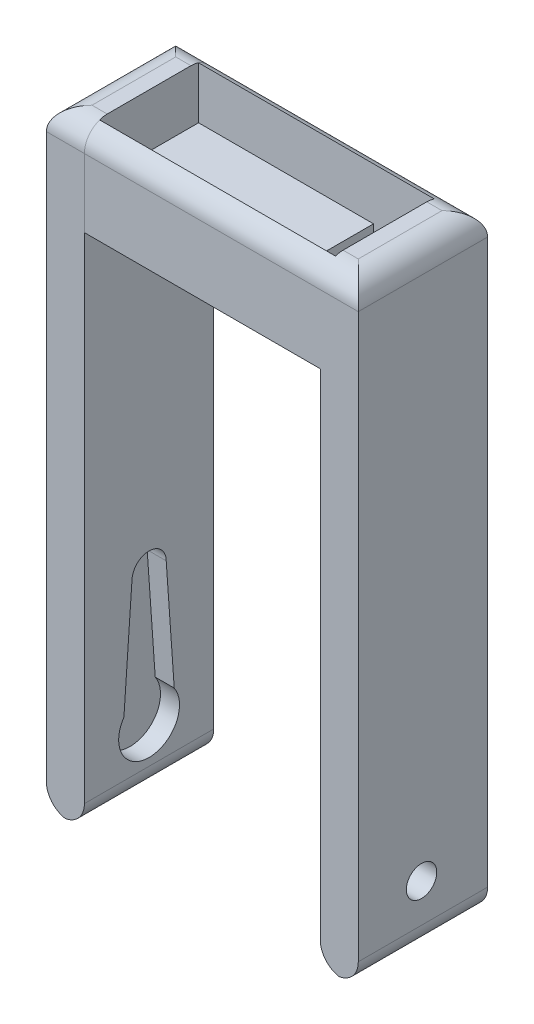
from build123d import *

# Parameters (mm, degrees)
SKETCH1_W             = 5
SKETCH1_H             = 17
BOSS_EXTRUDE1_DEPTH   = 80
BOSS_EXTRUDE1_2_DEPTH = 80
CUT_EXTRUDE1_DEPTH    = 2.5
BOSS_EXTRUDE2_REACH   = 91.359
SKETCH5_W             = 3
SKETCH5_H             = 13
CUT_EXTRUDE2_DEPTH    = 5
FILLET1_R             = 3
FILLET2_R             = 3
SKETCH6_R             = 2
CUT_EXTRUDE3_DEPTH    = 90.358827208


with BuildPart() as part:
    # Sketch1 → Boss-Extrude1 (new body)
    with BuildSketch(Plane(origin=(0, 0, 0), x_dir=(1, 0, 0), z_dir=(0, 1, 0))):
        with Locations((2.5, -8.5)):
            Rectangle(SKETCH1_W, SKETCH1_H)
    extrude(amount=BOSS_EXTRUDE1_DEPTH)

    # Sketch2 → Cut-Extrude1 (cut)
    with BuildSketch(Plane(origin=(5, 0, 0), x_dir=(0, 0, -1), z_dir=(1, 0, 0))):
        with BuildLine():
            Line((-10.75, 25.267799715), (-11.807189139, 10.25))
            ThreePointArc((-11.807189139, 10.25), (-8.5, 12), (-5.192810861, 10.25))
            Line((-5.192810861, 10.25), (-6.25, 25.267799715))
            ThreePointArc((-6.25, 25.267799715), (-8.5, 27.517799715), (-10.75, 25.267799715))
        make_face()
        with BuildLine():
            ThreePointArc((-5.192810861, 10.25), (-8.5, 12), (-11.807189139, 10.25))
            Line((-11.807189139, 10.25), (-11.807189139, 5.75))
            ThreePointArc((-11.807189139, 5.75), (-8.5, 4), (-5.192810861, 5.75))
            Line((-5.192810861, 5.75), (-5.192810861, 10.25))
        make_face()
        with BuildLine():
            Line((-11.807189139, 5.75), (-11.807189139, 10.25))
            ThreePointArc((-11.807189139, 10.25), (-12.5, 8), (-11.807189139, 5.75))
        make_face()
        with BuildLine():
            ThreePointArc((-4.5, 8), (-4.677124344, 9.177124344), (-5.192810861, 10.25))
            Line((-5.192810861, 10.25), (-5.192810861, 5.75))
            ThreePointArc((-5.192810861, 5.75), (-4.677124344, 6.822875656), (-4.5, 8))
        make_face()
    extrude(amount=-CUT_EXTRUDE1_DEPTH, mode=Mode.SUBTRACT)


with BuildPart() as body_2:
    # Sketch1 → Boss-Extrude1 2 (new body)
    with BuildSketch(Plane(origin=(0, 0, 0), x_dir=(1, 0, 0), z_dir=(0, 1, 0))):
        with Locations((38.5, -8.5)):
            Rectangle(SKETCH1_W, SKETCH1_H)
    extrude(amount=BOSS_EXTRUDE1_2_DEPTH)


    # Sketch4 → Boss-Extrude2 (add, up to next)
    with BuildSketch(Plane.ZY.offset(-36), mode=Mode.PRIVATE) as boss_extrude2_sk1:
        Polygon((2, 73), (15, 73), (15, 80), (17, 80), (17, 72), (17, 68), (0, 68), (0, 72), (0, 80), (2, 80), align=None)
    boss_extrude2_tool1 = extrude(boss_extrude2_sk1.sketch, amount=BOSS_EXTRUDE2_REACH, mode=Mode.PRIVATE) - part.part
    add(boss_extrude2_tool1.solids().sort_by_distance((36, 71.986726, 8.5))[0])

    # Sketch5 → Cut-Extrude2 (cut)
    with BuildSketch(Plane(origin=(0, 73, 0), x_dir=(1, 0, 0), z_dir=(0, 1, 0))):
        with Locations((29.5, -8.5)):
            Rectangle(SKETCH5_W, SKETCH5_H)
    extrude(amount=-CUT_EXTRUDE2_DEPTH, mode=Mode.SUBTRACT)

    # Fillet1
    # the kernel refuses this fillet: 3 mm, written as the material it takes off along each edge
    with BuildSketch(Plane(origin=(36, 0, 24.5), x_dir=(0, 1, 0), z_dir=(0, 0, -1)), Plane(origin=(41, 0, -7.5), x_dir=(0, 1, 0), z_dir=(0, 0, 1)), Plane(origin=(41, 80, -7.5), x_dir=(-1, 0, 0), z_dir=(0, 0, 1))) as fillet1_piece_1:
        with BuildLine():
            CenterArc((FILLET1_R, FILLET1_R), FILLET1_R, 180, 90)
            Line((0, FILLET1_R), (0, 0))
            Line((0, 0), (FILLET1_R, 0))
        make_face()
    extrude(amount=32, mode=Mode.SUBTRACT)
    with BuildSketch(Plane(origin=(-2.5, 80, 17), x_dir=(0, 0, -1), z_dir=(1, 0, 0)), Plane(origin=(48.5, 80, 0), x_dir=(0, 0, 1), z_dir=(-1, 0, 0))) as fillet1_piece_2:
        with BuildLine():
            CenterArc((FILLET1_R, -FILLET1_R), FILLET1_R, 90, 90)
            Line((0, -FILLET1_R), (0, 0))
            Line((0, 0), (FILLET1_R, 0))
        make_face()
    extrude(amount=51, mode=Mode.SUBTRACT)

    # Sketch6 → Cut-Extrude3 (cut, through all)
    with BuildSketch(Plane.ZY.offset(-36)):
        with Locations((8.686376561, 8.041960108)):
            Circle(SKETCH6_R)
    extrude(amount=-CUT_EXTRUDE3_DEPTH, mode=Mode.SUBTRACT)


with BuildPart() as part_1:
    add(part.part)

    # Fillet2
    # the kernel refuses this fillet: 3 mm, written as the material it takes off along each edge
    with BuildSketch(Plane(origin=(0, 0, 24.5), x_dir=(0, 1, 0), z_dir=(0, 0, -1)), Plane(origin=(5, 0, -7.5), x_dir=(0, 1, 0), z_dir=(0, 0, 1))) as fillet2_piece_1:
        with BuildLine():
            CenterArc((FILLET2_R, FILLET2_R), FILLET2_R, 180, 90)
            Line((0, FILLET2_R), (0, 0))
            Line((0, 0), (FILLET2_R, 0))
        make_face()
    extrude(amount=32, mode=Mode.SUBTRACT)
    with BuildSketch(Plane(origin=(12.5, 80, 17), x_dir=(0, 0, -1), z_dir=(-1, 0, 0))) as fillet2_piece_2:
        with BuildLine():
            CenterArc((FILLET2_R, FILLET2_R), FILLET2_R, 180, 90)
            Line((0, FILLET2_R), (0, 0))
            Line((0, 0), (FILLET2_R, 0))
        make_face()
    extrude(amount=20, mode=Mode.SUBTRACT)
    with BuildSketch(Plane(origin=(0, 80, 24.5), x_dir=(0, -1, 0), z_dir=(0, 0, -1))) as fillet2_piece_3:
        with BuildLine():
            CenterArc((FILLET2_R, -FILLET2_R), FILLET2_R, 90, 90)
            Line((0, -FILLET2_R), (0, 0))
            Line((0, 0), (FILLET2_R, 0))
        make_face()
    extrude(amount=32, mode=Mode.SUBTRACT)
    with BuildSketch(Plane(origin=(-7.5, 80, 0), x_dir=(0, -1, 0), z_dir=(1, 0, 0))) as fillet2_piece_4:
        with BuildLine():
            CenterArc((FILLET2_R, -FILLET2_R), FILLET2_R, 90, 90)
            Line((0, -FILLET2_R), (0, 0))
            Line((0, 0), (FILLET2_R, 0))
        make_face()
    extrude(amount=20, mode=Mode.SUBTRACT)


solid = Compound([body_2.part, part_1.part])
